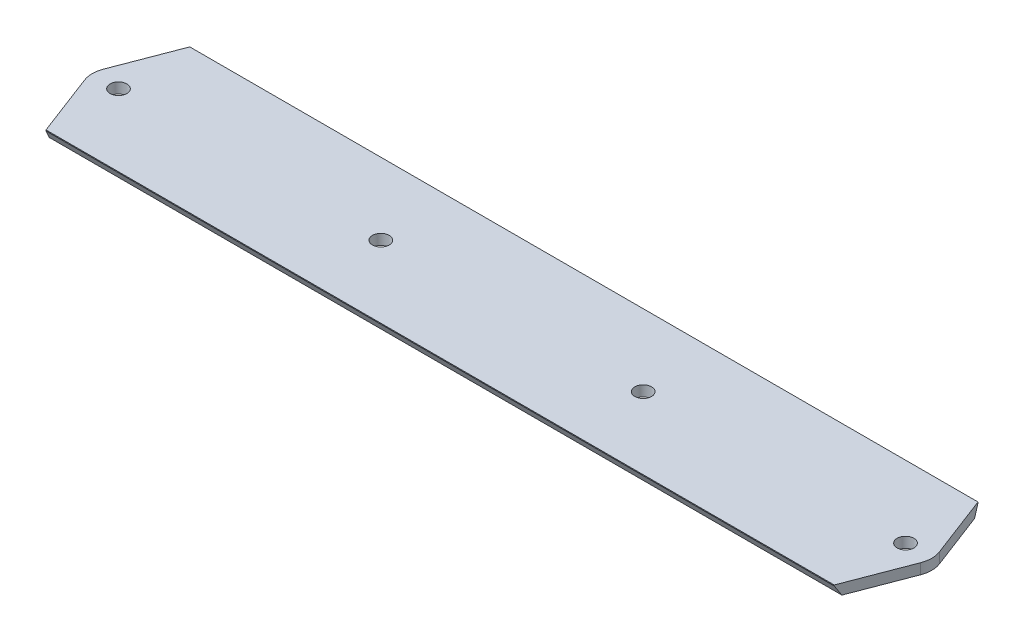
from build123d import *

# Parameters (mm, degrees)
SKETCH_1_R          = 1.6
EXTRUDE_1_DEPTH     = 2
CUT_EXTRUDE_1_DEPTH = 161.623784042
CHAMFER_1_SIZE      = 0.2
CHAMFER_1_SIZE2     = 0.1
CHAMFER_2_SIZE2     = 0.2
CHAMFER_2_SIZE      = 0.1


with BuildPart() as part:
    # Эскиз1 → Бобышка-Вытянуть1 (new body)
    # profile 1 of 3: a face of its own
    with BuildSketch(Plane(origin=(0, 0, 0), x_dir=(1, 0, 0), z_dir=(0, 1, 0))):
        with BuildLine():
            Line((75, 14), (-75, 14))
            Line((-75, 14), (-75, 1.6))
            ThreePointArc((-75, 1.6), (-73.86862915, 1.13137085), (-73.4, 0))
            ThreePointArc((-73.4, 0), (-73.86862915, -1.13137085), (-75, -1.6))
            Line((-75, -1.6), (-75, -14))
            Line((-75, -14), (75, -14))
            Line((75, -14), (75, -1.6))
            ThreePointArc((75, -1.6), (73.4, 0), (75, 1.6))
            Line((75, 1.6), (75, 14))
        make_face()
        with Locations(Location((-25, 0, 0), (0, 0, 270))):
            Circle(SKETCH_1_R, mode=Mode.SUBTRACT)
        with Locations(Location((25, 0, 0), (0, 0, 270))):
            Circle(SKETCH_1_R, mode=Mode.SUBTRACT)
    # profile 2 of 3: a face of its own
    with BuildSketch(Plane(origin=(0, 0, 0), x_dir=(1, 0, 0), z_dir=(0, 1, 0))):
        with BuildLine():
            Line((79.670248868, 1.785714286), (75, 14))
            Line((75, 14), (75, 1.6))
            ThreePointArc((75, 1.6), (76.13137085, 1.13137085), (76.6, 0))
            ThreePointArc((76.6, 0), (76.13137085, -1.13137085), (75, -1.6))
            Line((75, -1.6), (75, -14))
            Line((75, -14), (79.670248868, -1.785714286))
            ThreePointArc((79.670248868, -1.785714286), (80, 0), (79.670248868, 1.785714286))
        make_face()
    # profile 3 of 3: a face of its own
    with BuildSketch(Plane(origin=(0, 0, 0), x_dir=(1, 0, 0), z_dir=(0, 1, 0))):
        with BuildLine():
            Line((-75, 1.6), (-75, 14))
            Line((-75, 14), (-79.670248868, 1.785714286))
            ThreePointArc((-79.670248868, 1.785714286), (-80, 0), (-79.670248868, -1.785714286))
            Line((-79.670248868, -1.785714286), (-75, -14))
            Line((-75, -14), (-75, -1.6))
            ThreePointArc((-75, -1.6), (-76.6, 0), (-75, 1.6))
        make_face()
    extrude(amount=EXTRUDE_1_DEPTH)

    # Эскиз3 → Вырез-Вытянуть1 (cut, through all)
    with BuildSketch(Plane.ZY.offset(80)):
        Polygon((-12.645299462, 0), (-14, 0), (-14, 2), (-13.8, 2), align=None)
        Polygon((14, 0), (14, 2), (13.8, 2), (12.645299462, 0), align=None)
    extrude(amount=-CUT_EXTRUDE_1_DEPTH, mode=Mode.SUBTRACT)

    # Фаска1
    chamfer_1_edges = [part.edges().sort_by_distance(p)[0] for p in [
        (0, 2, -13.8),
    ]]
    chamfer_1_side = [part.faces().sort_by_distance(p)[0] for p in [
        (0, 0.999022738, -13.222085508),
    ]]
    chamfer(chamfer_1_edges, length=CHAMFER_1_SIZE, length2=CHAMFER_1_SIZE2, reference=chamfer_1_side[0])

    # Фаска2
    chamfer_2_edges = [part.edges().sort_by_distance(p)[0] for p in [
        (0, 2, 13.8),
    ]]
    chamfer_2_side = [part.faces().sort_by_distance(p)[0] for p in [
        (0, 2, 13.798),
    ]]
    chamfer(chamfer_2_edges, length=CHAMFER_2_SIZE - 0.0001, length2=CHAMFER_2_SIZE2 - 0.0001, reference=chamfer_2_side[0])  # a hair under: the kernel refuses the full size


solid = part.part
